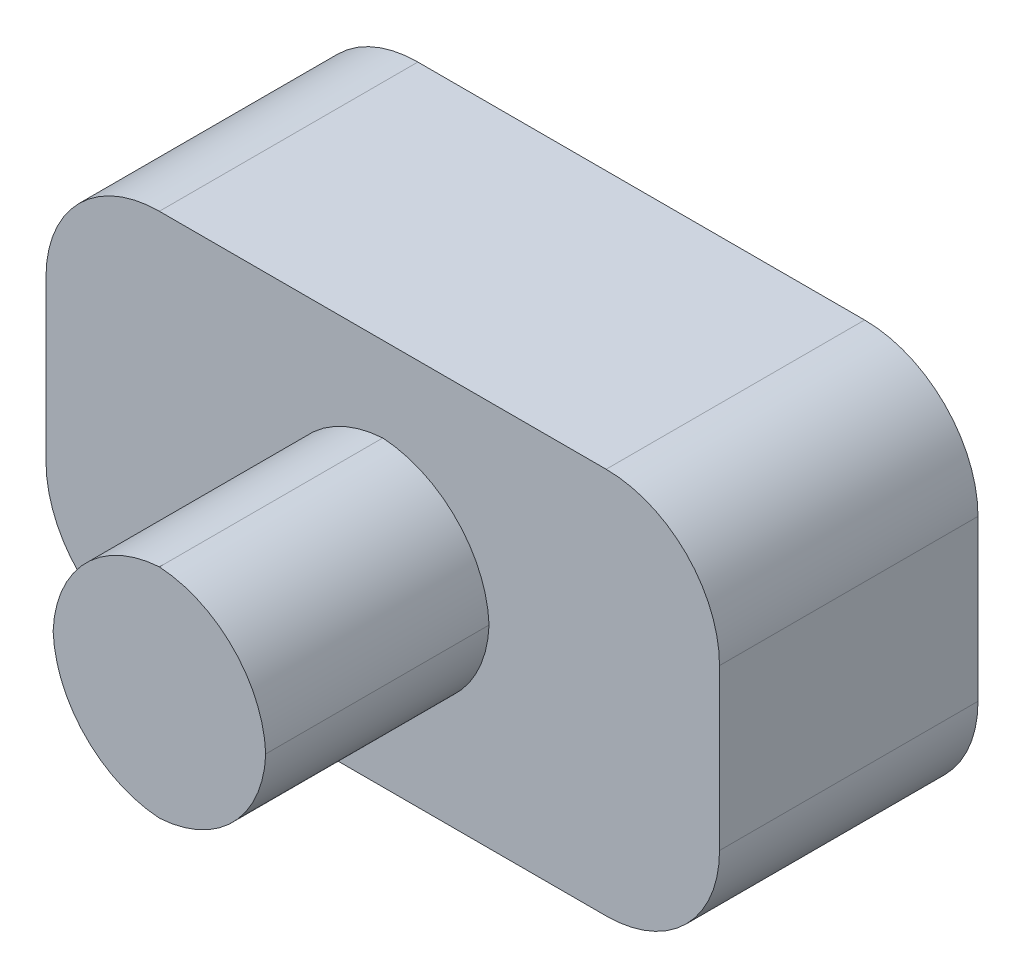
from build123d import *

# Parameters (mm, degrees)
SKETCH1_W           = 47.674288096
SKETCH1_H           = 48.856295238
BOSS_EXTRUDE1_DEPTH = 50.038
SKETCH1_4_W         = 150.902911904
SKETCH1_4_H         = 86.68052381
SKETCH1_4_W_2       = 47.674288096
SKETCH1_4_H_2       = 48.856295238
BOSS_EXTRUDE2_DEPTH = 57.912
FILLET1_R           = 25.4
FILLET2_R           = 25.4
SCALE2_SCALE        = 0.4


with BuildPart() as part:
    # Sketch1 → Boss-Extrude1 (new body)
    with BuildSketch(Plane.XY):
        Rectangle(SKETCH1_W, SKETCH1_H)
    extrude(amount=BOSS_EXTRUDE1_DEPTH)

    # Fillet2
    # the kernel refuses this fillet: 25.4 mm, written as the material it takes off along each edge
    with BuildSketch(Plane(origin=(23.837144048, 24.428147619, -63.5), x_dir=(-1, 0, 0), z_dir=(0, 0, 1)), Plane(origin=(23.837144048, -24.428147619, -63.5), x_dir=(0, 1, 0), z_dir=(0, 0, 1)), Plane(origin=(-23.837144048, -24.428147619, -63.5), x_dir=(1, 0, 0), z_dir=(0, 0, 1))) as fillet2_piece_1:
        with BuildLine():
            CenterArc((FILLET2_R, FILLET2_R), FILLET2_R, 180, 90)
            Line((0, FILLET2_R), (0, 0))
            Line((0, 0), (FILLET2_R, 0))
        make_face()
    extrude(amount=177.038, mode=Mode.SUBTRACT)
    with BuildSketch(Plane(origin=(-23.837144048, 24.428147619, -63.5), x_dir=(1, 0, 0), z_dir=(0, 0, 1))) as fillet2_piece_2:
        with BuildLine():
            CenterArc((FILLET2_R, -FILLET2_R), FILLET2_R, 90, 90)
            Line((0, -FILLET2_R), (0, 0))
            Line((0, 0), (FILLET2_R, 0))
        make_face()
    extrude(amount=177.038, mode=Mode.SUBTRACT)


with BuildPart() as body_2:
    # Sketch1<4> → Boss-Extrude2 (new body)
    with BuildSketch(Plane.XY):
        Rectangle(SKETCH1_4_W, SKETCH1_4_H)
        Rectangle(SKETCH1_4_W_2, SKETCH1_4_H_2, mode=Mode.SUBTRACT)
    extrude(amount=-BOSS_EXTRUDE2_DEPTH)

    # Fillet1
    # the kernel refuses this fillet: 25.4 mm, written as the material it adds along each edge
    with BuildSketch(Plane(origin=(-23.837144048, 24.428147619, 0), x_dir=(0, -1, 0), z_dir=(0, 0, -1))) as fillet1_piece_1:
        with BuildLine():
            CenterArc((FILLET1_R, -FILLET1_R), FILLET1_R, 90, 90)
            Line((0, -FILLET1_R), (0, 0))
            Line((0, 0), (FILLET1_R, 0))
        make_face()
    extrude(amount=57.912)
    with BuildSketch(Plane(origin=(23.837144048, 24.428147619, 0), x_dir=(0, -1, 0), z_dir=(0, 0, -1)), Plane(origin=(23.837144048, -24.428147619, 0), x_dir=(-1, 0, 0), z_dir=(0, 0, -1)), Plane(origin=(-23.837144048, -24.428147619, 0), x_dir=(0, 1, 0), z_dir=(0, 0, -1))) as fillet1_piece_2:
        with BuildLine():
            CenterArc((FILLET1_R, FILLET1_R), FILLET1_R, 180, 90)
            Line((0, FILLET1_R), (0, 0))
            Line((0, 0), (FILLET1_R, 0))
        make_face()
    extrude(amount=57.912)
    # the kernel refuses this fillet: 25.4 mm, written as the material it takes off along each edge
    with BuildSketch(Plane(origin=(-75.451455952, 43.340261905, 63.5), x_dir=(1, 0, 0), z_dir=(0, 0, -1)), Plane(origin=(75.451455952, 43.340261905, 63.5), x_dir=(0, -1, 0), z_dir=(0, 0, -1))) as fillet1_2_piece_1:
        with BuildLine():
            CenterArc((FILLET1_R, FILLET1_R), FILLET1_R, 180, 90)
            Line((0, FILLET1_R), (0, 0))
            Line((0, 0), (FILLET1_R, 0))
        make_face()
    extrude(amount=184.912, mode=Mode.SUBTRACT)
    with BuildSketch(Plane(origin=(-75.451455952, -43.340261905, 63.5), x_dir=(1, 0, 0), z_dir=(0, 0, -1)), Plane(origin=(75.451455952, -43.340261905, 63.5), x_dir=(0, 1, 0), z_dir=(0, 0, -1))) as fillet1_2_piece_2:
        with BuildLine():
            CenterArc((FILLET1_R, -FILLET1_R), FILLET1_R, 90, 90)
            Line((0, -FILLET1_R), (0, 0))
            Line((0, 0), (FILLET1_R, 0))
        make_face()
    extrude(amount=184.912, mode=Mode.SUBTRACT)


with BuildPart() as body_2_1:
    # Scale2: scaled about (0, 0, 0)
    add(body_2.part.scale(SCALE2_SCALE))


with BuildPart() as part_1:
    # Scale2: scaled about (0, 0, 0)
    add(part.part.scale(SCALE2_SCALE))


solid = Compound([body_2_1.part, part_1.part])
